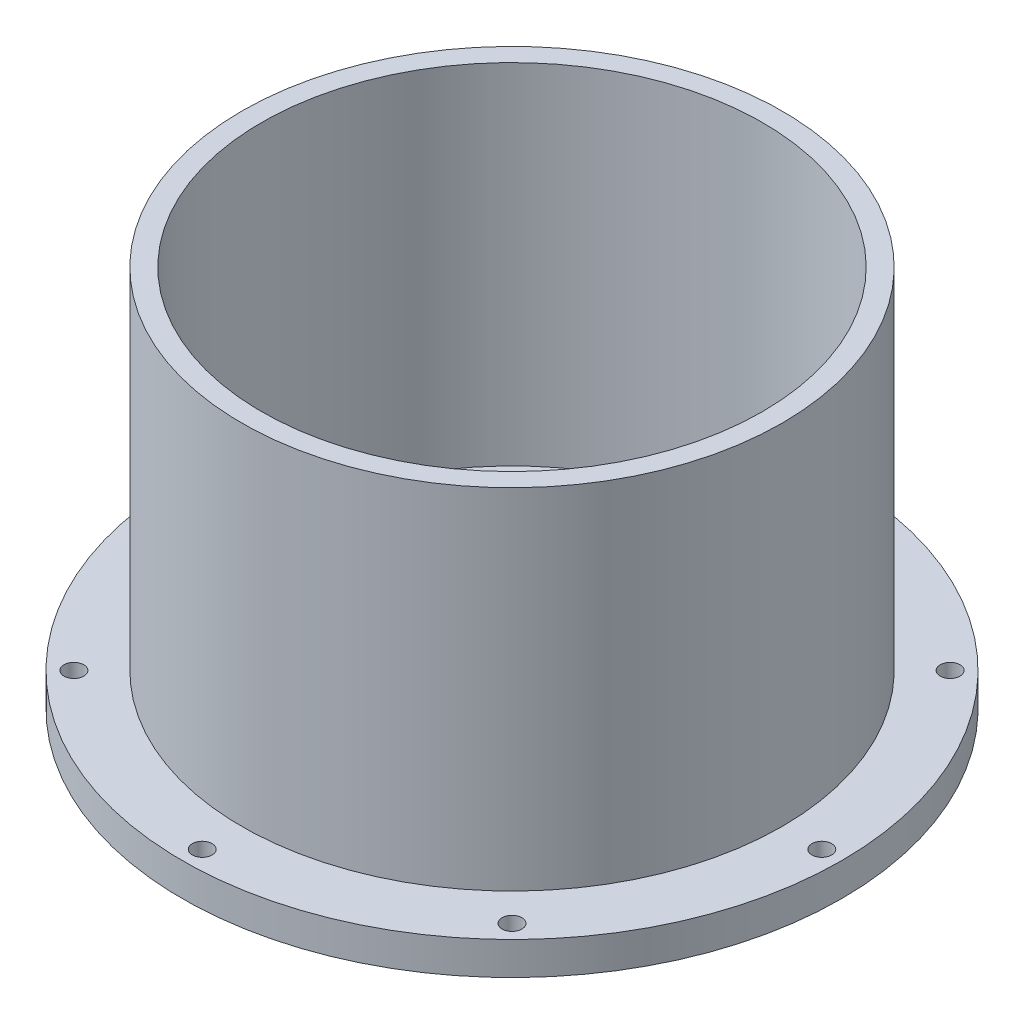
from build123d import *

# Parameters (mm, degrees)
SKETCH3_R          = 1
SKETCH3_R_2        = 1.5
CUT_EXTRUDE2_DEPTH = 10


with BuildPart() as part:
    # Sketch2 → Revolve1 (revolve)
    with BuildSketch(Plane.XY):
        Polygon((0, 5), (0, 0), (50, 0), (50, 5), (41, 5), (41, 58), (38, 58), (38, 5), align=None)
    revolve(axis=Axis((0, 0, 0), (0, 1, 0)))

    # Sketch3 → Cut-Extrude2 (cut)
    with BuildSketch(Plane(origin=(0, 0, 0), x_dir=(1, 0, 0), z_dir=(0, 1, 0))):
        with Locations((-13.5, 12)):
            Circle(SKETCH3_R)
        with Locations((13.5, 12)):
            Circle(SKETCH3_R)
        with Locations((-13.5, 4)):
            Circle(SKETCH3_R)
        with Locations((-13.5, -4)):
            Circle(SKETCH3_R)
        with Locations((13.5, 4)):
            Circle(SKETCH3_R)
        with Locations((13.5, -4)):
            Circle(SKETCH3_R)
        with Locations((-13.5, 20)):
            Circle(SKETCH3_R)
        with Locations((13.5, 20)):
            Circle(SKETCH3_R)
        with Locations((0, -47)):
            Circle(SKETCH3_R_2)
        with Locations((-33.234018716, -33.234018716)):
            Circle(SKETCH3_R_2)
        with Locations((-47, 0)):
            Circle(SKETCH3_R_2)
        with Locations((-33.234018716, 33.234018716)):
            Circle(SKETCH3_R_2)
        with Locations((0, 47)):
            Circle(SKETCH3_R_2)
        with Locations((33.234018716, 33.234018716)):
            Circle(SKETCH3_R_2)
        with Locations((47, 0)):
            Circle(SKETCH3_R_2)
        with Locations((33.234018716, -33.234018716)):
            Circle(SKETCH3_R_2)
    extrude(amount=CUT_EXTRUDE2_DEPTH, mode=Mode.SUBTRACT)


solid = part.part
